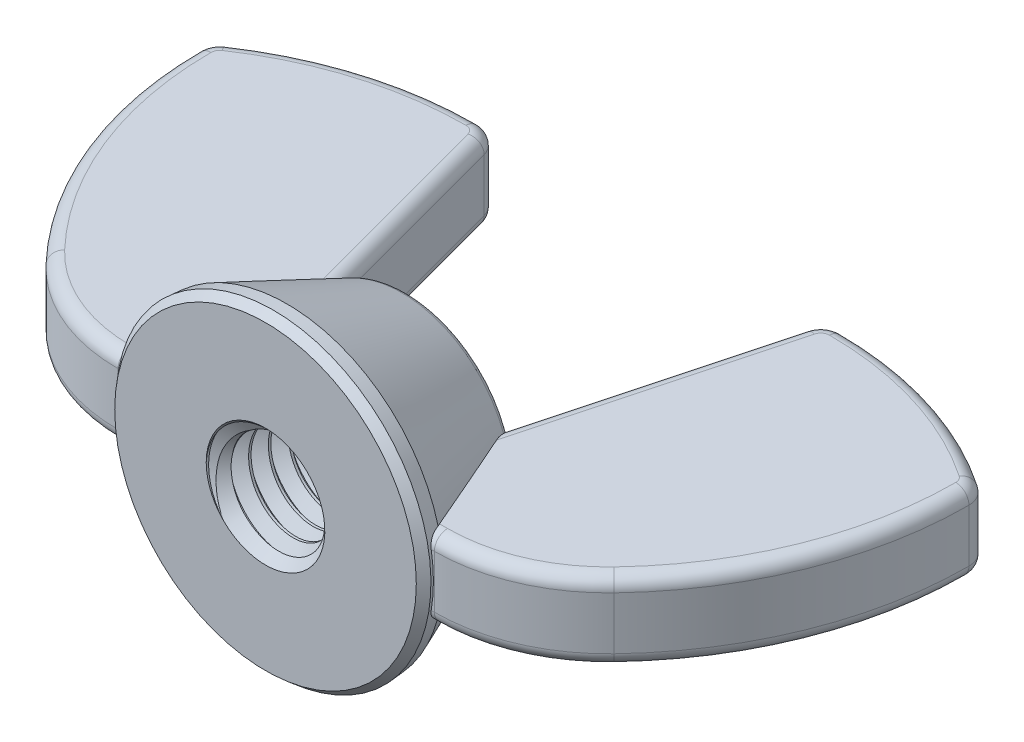
from build123d import *

# Parameters (mm, degrees)
EXTRUDE2_DEPTH     = 1
SKETCH3_R          = 4
EXTRUDE1_DEPTH     = 0.54
EXTRUDE1_DRAFT     = -5
SKETCH15_R         = 3.952756122
EXTRUDE3_DEPTH     = 3.06
EXTRUDE3_TAPER     = 22.581536516
FILLET3_R          = 0.254
SKETCH4_R          = 1.5
CUT_EXTRUDE1_DEPTH = 15.527990226
SWEEP1_PITCH       = 0.5
SKETCH7_R          = 4
CUT_EXTRUDE2_DEPTH = 15.527990253
SKETCH8_R          = 3.952756122
CUT_EXTRUDE3_DEPTH = 13.3297405
SKETCH11_R         = 1.4492
CUT_EXTRUDE5_DEPTH = 13.329740468
CUT_EXTRUDE5_TAPER = 45
CHAMFER1_SIZE      = 0.2025
CHAMFER1_SIZE2     = 0.186920125
FILLET4_R          = 0.333333333


with BuildPart() as part:
    # Sketch13 → Extrude2 (new, symmetric)
    with BuildSketch(Plane(origin=(0, 0, 0), x_dir=(1, 0, 0), z_dir=(0, 1, 0))):
        with BuildLine():
            Line((2.454661552, 0.27), (4, 0.27))
            ThreePointArc((4, 0.27), (5.731753934, 0.625019574), (7.184125317, 1.632803257))
            ThreePointArc((7.184125317, 1.632803257), (9.084678564, 4.588262139), (9.75, 8.038506658))
            ThreePointArc((9.75, 8.038506658), (9.684970885, 8.299324193), (9.505107169, 8.499083087))
            ThreePointArc((9.505107169, 8.499083087), (7.162624929, 9.616389801), (4.595829154, 10))
            ThreePointArc((4.595829154, 10), (4.25762836, 9.8851963), (4.059203695, 9.588232803))
            Line((4.059203695, 9.588232803), (2.454661552, 3.6))
            Line((2.454661552, 3.6), (2.454661552, 0.27))
        make_face()
    extrude(amount=EXTRUDE2_DEPTH, both=True)

    # Fillet4
    fillet4_edges = [part.edges().sort_by_distance(p)[0] for p in [
        (5.731753934, 1, -0.625019574),
        (3.227330776, -1, -0.27),
        (9.084678564, 1, -4.588262139),
        (9.684970885, 1, -8.299324193),
        (7.162624929, 1, -9.616389801),
        (4.25762836, 1, -9.8851963),
        (3.256932623, 1, -6.594116401),
        (3.227330776, 1, -0.27),
        (3.256932623, -1, -6.594116401),
        (4.25762836, -1, -9.8851963),
        (7.162624929, -1, -9.616389801),
        (9.684970885, -1, -8.299324193),
        (9.084678564, -1, -4.588262139),
        (5.731753934, -1, -0.625019574),
    ]]
    fillet(fillet4_edges, radius=FILLET4_R)


with BuildPart() as body_2:
    # Sketch3 → Extrude1 (with draft: the straight prism first)
    with BuildSketch(Plane.XY):
        Circle(SKETCH3_R)
    extrude(amount=-EXTRUDE1_DEPTH)
    # Extrude1: the draft: its side faces are tilted about the plane it starts from
    extrude1_sides = [body_2.faces().sort_by_distance(p)[0] for p in [
        (-4, 0, -0.27),
    ]]
    draft(extrude1_sides, Plane.XY, EXTRUDE1_DRAFT)

    # Sketch15 → Extrude3 (add)
    with BuildSketch(Plane(origin=(0, 0, -0.54), x_dir=(-1, 0, 0), z_dir=(0, 0, -1))):
        Circle(SKETCH15_R)
    extrude(amount=EXTRUDE3_DEPTH, taper=EXTRUDE3_TAPER)

    # Fillet3
    fillet3_edges = [body_2.edges().sort_by_distance(p)[0] for p in [
        (2.680157846, 0, -3.6),
    ]]
    fillet(fillet3_edges, radius=FILLET3_R)

    # Sketch4 → Cut-Extrude1 (cut, through all)
    with BuildSketch(Plane.XY):
        Circle(SKETCH4_R)
    extrude(amount=-CUT_EXTRUDE1_DEPTH, mode=Mode.SUBTRACT)

    # Sweep1: the profile of Sketch6 profile screwed along a right-hand helix of 11.2 turns, 6 arcs to a turn; built about Z, then put on its axis
    sweep1_z = Axis((0, 0, 0), (0, 0, 1))
    sweep1_corners = [(1.5003, 0, -0.437673205), (1.175240474, 0, -0.25), (1.175240474, 0, -0.1875), (1.5003, 0, 0.000173205)]
    with BuildLine(mode=Mode.PRIVATE) as sweep1_profile:
        Line(sweep1_corners[0], sweep1_corners[1])
        Line(sweep1_corners[1], sweep1_corners[2])
        Line(sweep1_corners[2], sweep1_corners[3])
        Line(sweep1_corners[3], sweep1_corners[0])
    sweep1_cap = Face(sweep1_profile.wire())
    sweep1_turn_angles = [0, 30, 60, 90, 120, 150, 180, 210, 240, 270, 300, 330, 360]
    sweep1_turn_weights = [1, 0.8660254037844387, 1, 0.8660254037844387, 1, 0.8660254037844387, 1, 0.8660254037844387, 1, 0.8660254037844387, 1, 0.8660254037844387, 1]
    sweep1_turn_rails = [Edge.make_bspline([Vector(p[0], p[1], 0).rotate(sweep1_z, sweep1_turn_angles[k]) / sweep1_turn_weights[k] + Vector(0, 0, p[2] + SWEEP1_PITCH * sweep1_turn_angles[k] / 360) for k in range(13)], [0, 0, 0, 1, 1, 2, 2, 3, 3, 4, 4, 5, 5, 6, 6, 6], 2, sweep1_turn_weights) for p in sweep1_corners]
    sweep1_turn_sides = [Face.make_surface_from_curves(sweep1_turn_rails[p[0]], sweep1_turn_rails[p[1]]) for p in [(0, 1), (1, 2), (2, 3), (3, 0)]]
    sweep1_last_angles = [3960, 3990, 4020, 4026, 4032]
    sweep1_last_weights = [1, 0.8660254037844387, 1, 0.9945218953682692, 1]
    sweep1_last_rails = [Edge.make_bspline([Vector(p[0], p[1], 0).rotate(sweep1_z, sweep1_last_angles[k]) / sweep1_last_weights[k] + Vector(0, 0, p[2] + SWEEP1_PITCH * sweep1_last_angles[k] / 360) for k in range(5)], [0, 0, 0, 1, 1, 2, 2, 2], 2, sweep1_last_weights) for p in sweep1_corners]
    sweep1_last_sides = [Face.make_surface_from_curves(sweep1_last_rails[p[0]], sweep1_last_rails[p[1]]) for p in [(0, 1), (1, 2), (2, 3), (3, 0)]]
    sweep1 = Plane(origin=(0, 0, 0), x_dir=(-1, 0, 0), z_dir=(0, 0, -1)) * Solid(Shell([*[p.moved(Location((0, 0, SWEEP1_PITCH * i))) for i in range(11) for p in sweep1_turn_sides], *sweep1_last_sides, sweep1_cap, sweep1_cap.rotate(sweep1_z, 4032).moved(Location((0, 0, SWEEP1_PITCH * 4032 / 360)))]))
    add(sweep1)

    # Sketch7 → Cut-Extrude2 (cut, through all)
    with BuildSketch(Plane.XY):
        Circle(SKETCH7_R)
    extrude(amount=CUT_EXTRUDE2_DEPTH, mode=Mode.SUBTRACT)

    # Sketch8 → Cut-Extrude3 (cut, through all)
    with BuildSketch(Plane.XY.offset(-3.6)):
        Circle(SKETCH8_R)
    extrude(amount=-CUT_EXTRUDE3_DEPTH, mode=Mode.SUBTRACT)

    # Cut-Extrude4 cone 1 section (through the dimple's axis) → Cut-Extrude4 (revolve, cut)
    with BuildSketch(Plane(origin=(0, 0, 0), x_dir=(0, -1, 0), z_dir=(1, 0, 0))):
        Polygon((0, 0), (1.5, 0), (0, 1.5), align=None)
    revolve(axis=Axis((0, 0, 0), (0, 0, -1)), mode=Mode.SUBTRACT)

    # Sketch11 → Cut-Extrude5 (cut, through all)
    with BuildSketch(Plane.XY.offset(-3.6)):
        Circle(SKETCH11_R)
    extrude(amount=CUT_EXTRUDE5_DEPTH, taper=CUT_EXTRUDE5_TAPER, mode=Mode.SUBTRACT)

    # Chamfer1
    chamfer1_edges = [body_2.edges().sort_by_distance(p)[0] for p in [
        (-4, 0, 0),
    ]]
    chamfer1_side = [body_2.faces().sort_by_distance(p)[0] for p in [
        (-3.976378061, 0, -0.27),
    ]]
    chamfer(chamfer1_edges, length=CHAMFER1_SIZE, length2=CHAMFER1_SIZE2, reference=chamfer1_side[0])


with BuildPart() as body_3:
    # Mirror6: mirrored copy
    add(part.part.mirror(Plane(origin=(0, 0, 0), x_dir=(0, 0, 1), z_dir=(1, 0, 0))))

    # Combine2: union part, body 2
    add(part.part)
    add(body_2.part)


solid = body_3.part
